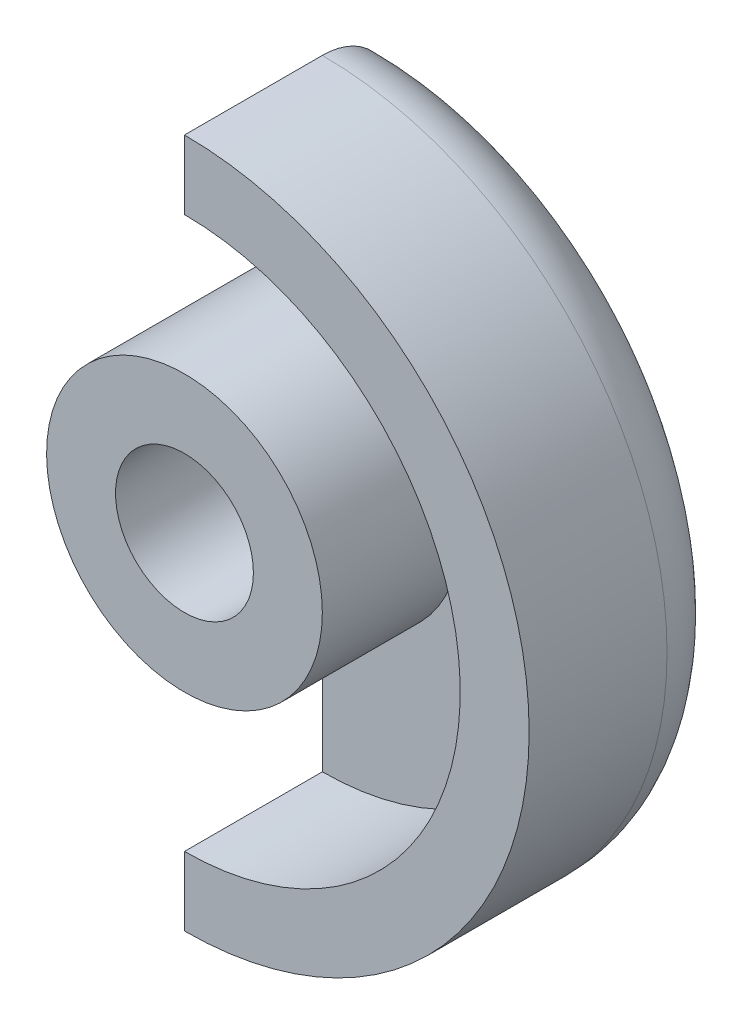
from build123d import *

# Parameters (mm, degrees)
SKETCH1_R           = 2
SKETCH1_R_2         = 1
BOSS_EXTRUDE1_DEPTH = 2
BOSS_EXTRUDE2_DEPTH = 2
BOSS_EXTRUDE3_START = -1
SKETCH5_R           = 1
BOSS_EXTRUDE3_DEPTH = 1
CHAMFER1_SIZE       = 1
FILLET1_R           = 1


with BuildPart() as part:
    # Sketch1 → Boss-Extrude1 (new body)
    with BuildSketch(Plane.XY):
        Circle(SKETCH1_R)
        Circle(SKETCH1_R_2, mode=Mode.SUBTRACT)
    extrude(amount=BOSS_EXTRUDE1_DEPTH)



with BuildPart() as body_2:
    # Sketch2 → Boss-Extrude2 (new body)
    with BuildSketch(Plane.XY):
        with BuildLine():
            Line((0, 5), (0, 4))
            ThreePointArc((0, 4), (4, 0), (0, -4))
            Line((0, -4), (0, -5))
            ThreePointArc((0, -5), (5, 0), (0, 5))
        make_face()
    extrude(amount=BOSS_EXTRUDE2_DEPTH)


with BuildPart() as part_1:
    add(part.part)

    add(body_2.part)  # Boss-Extrude3 merges body 2
    # Sketch5 → Boss-Extrude3 (add)
    with BuildSketch(Plane.XY.offset(BOSS_EXTRUDE3_START)):
        with BuildLine():
            Line((0, 5), (0, 2))
            ThreePointArc((0, 2), (-2, 0), (0, -2))
            Line((0, -2), (0, -5))
            ThreePointArc((0, -5), (5, 0), (0, 5))
        make_face()
        Circle(SKETCH5_R, mode=Mode.SUBTRACT)
    extrude(amount=BOSS_EXTRUDE3_DEPTH)

    # Chamfer1
    chamfer1_edges = [part_1.edges().sort_by_distance(p)[0] for p in [
        (-1, 0, -1),
    ]]
    chamfer(chamfer1_edges, length=CHAMFER1_SIZE - 0.0001)  # a hair under: the kernel refuses the full size

    # Fillet1
    fillet1_edges = [part_1.edges().sort_by_distance(p)[0] for p in [
        (0, -2, -0.5),
        (0, 2, -0.5),
        (5, 0, -1),
    ]]
    fillet(fillet1_edges, radius=FILLET1_R)


solid = part_1.part
